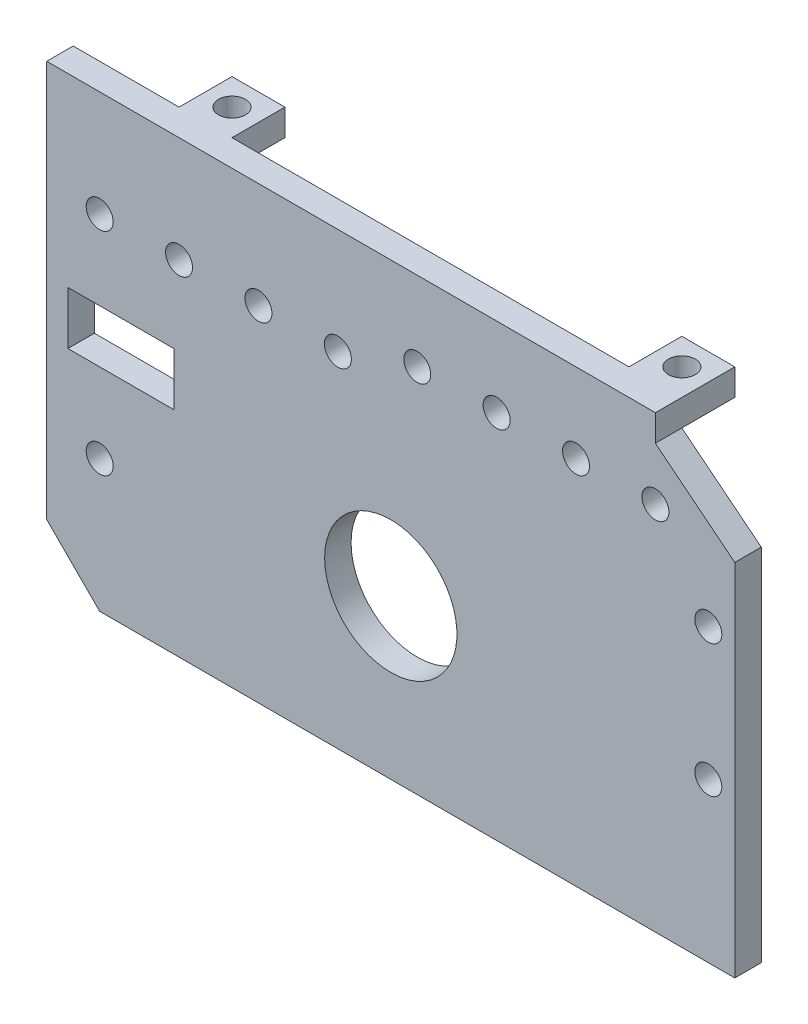
from build123d import *

# Parameters (mm, degrees)
SKETCH1_W           = 160
SKETCH1_H           = 85
SKETCH1_R           = 5
BOSS_EXTRUDE1_DEPTH = 5
SKETCH3_W           = 30
SKETCH3_H           = 85
CUT_EXTRUDE2_DEPTH  = 15
SKETCH5_R           = 2.55
CUT_EXTRUDE3_DEPTH  = 15
CHAMFER1_SIZE       = 10
SKETCH6_W           = 10
SKETCH6_H           = 5
BOSS_EXTRUDE2_DEPTH = 10
SKETCH7_R           = 2.55
CUT_EXTRUDE4_DEPTH  = 114.578166916
SKETCH8_R           = 2.55
CUT_EXTRUDE5_DEPTH  = 92.821838361
SKETCH9_W           = 20
SKETCH9_H           = 10
CUT_EXTRUDE6_DEPTH  = 10
CUT_EXTRUDE7_DEPTH  = 10
SKETCH11_R          = 5
BOSS_EXTRUDE3_DEPTH = 5
SKETCH12_R          = 12.5
CUT_EXTRUDE8_DEPTH  = 5


with BuildPart() as part:
    # Sketch1 → Boss-Extrude1 (new body)
    with BuildSketch(Plane.XY):
        Rectangle(SKETCH1_W, SKETCH1_H)
        Circle(SKETCH1_R, mode=Mode.SUBTRACT)
    extrude(amount=BOSS_EXTRUDE1_DEPTH)

    # Sketch3 → Cut-Extrude2 (cut)
    with BuildSketch(Plane.XY.offset(5)):
        with Locations((-65, 0)):
            Rectangle(SKETCH3_W, SKETCH3_H)
    extrude(amount=-CUT_EXTRUDE2_DEPTH, mode=Mode.SUBTRACT)

    # Sketch5 → Cut-Extrude3 (cut)
    with BuildSketch(Plane.XY.offset(5)):
        with Locations((65, 27.5)):
            Circle(SKETCH5_R)
        with Locations((50, 27.5)):
            Circle(SKETCH5_R)
        with Locations((35, 27.5)):
            Circle(SKETCH5_R)
        with Locations((20, 27.5)):
            Circle(SKETCH5_R)
        with Locations((5, 22.5)):
            Circle(SKETCH5_R)
        with Locations((-10, 22.5)):
            Circle(SKETCH5_R)
        with Locations((-25, 22.5)):
            Circle(SKETCH5_R)
        with Locations((-40, 22.5)):
            Circle(SKETCH5_R)
        with Locations((-40, -17.5)):
            Circle(SKETCH5_R)
    extrude(amount=-CUT_EXTRUDE3_DEPTH, mode=Mode.SUBTRACT)

    # Chamfer1
    chamfer1_edges = [part.edges().sort_by_distance(p)[0] for p in [
        (-50, -42.5, 2.5),
    ]]
    chamfer(chamfer1_edges, length=CHAMFER1_SIZE)

    # Sketch6 → Boss-Extrude2 (add)
    with BuildSketch(Plane(origin=(0, 0, 0), x_dir=(-1, 0, 0), z_dir=(0, 0, -1))):
        with Locations((25, -40)):
            Rectangle(SKETCH6_W, SKETCH6_H)
        with Locations((-60, -40)):
            Rectangle(SKETCH6_W, SKETCH6_H)
    boss_extrude2 = extrude(amount=BOSS_EXTRUDE2_DEPTH)

    # Sketch7 → Cut-Extrude4 (cut, through all)
    with BuildSketch(Plane(origin=(0, -37.5, 0), x_dir=(1, 0, 0), z_dir=(0, 1, 0))):
        with Locations((60, 5)):
            Circle(SKETCH7_R)
        with Locations((-25, 5)):
            Circle(SKETCH7_R)
    cut_extrude4 = extrude(amount=-CUT_EXTRUDE4_DEPTH, mode=Mode.SUBTRACT)

    # Mirror1: Boss-Extrude2 across plane
    add(boss_extrude2.mirror(Plane.ZX))

    # Mirror2: Cut-Extrude4 across plane
    add(cut_extrude4.mirror(Plane.ZX), mode=Mode.SUBTRACT)

    # Sketch8 → Cut-Extrude5 (cut, through all)
    with BuildSketch(Plane.XY.offset(5)):
        with Locations((75, 12.5)):
            Circle(SKETCH8_R)
        with Locations((75, -12.5)):
            Circle(SKETCH8_R)
    extrude(amount=-CUT_EXTRUDE5_DEPTH, mode=Mode.SUBTRACT)

    # Sketch9 → Cut-Extrude6 (cut)
    with BuildSketch(Plane.XY.offset(5)):
        with Locations((-36, 2.5)):
            Rectangle(SKETCH9_W, SKETCH9_H)
    extrude(amount=-CUT_EXTRUDE6_DEPTH, mode=Mode.SUBTRACT)

    # Sketch10 → Cut-Extrude7 (cut)
    with BuildSketch(Plane.XY.offset(5)):
        Polygon((65, 42.5), (65, 37.5), (80, 25.5), (80, 42.5), align=None)
    extrude(amount=-CUT_EXTRUDE7_DEPTH, mode=Mode.SUBTRACT)

    # Sketch11 → Boss-Extrude3 (add)
    with BuildSketch(Plane(origin=(0, 0, 0), x_dir=(-1, 0, 0), z_dir=(0, 0, -1))):
        Circle(SKETCH11_R)
    extrude(amount=-BOSS_EXTRUDE3_DEPTH)

    # Sketch12 → Cut-Extrude8 (cut)
    with BuildSketch(Plane(origin=(0, 0, 0), x_dir=(-1, 0, 0), z_dir=(0, 0, -1))):
        with Locations((-15, -12.5)):
            Circle(SKETCH12_R)
    extrude(amount=-CUT_EXTRUDE8_DEPTH, mode=Mode.SUBTRACT)


solid = part.part
